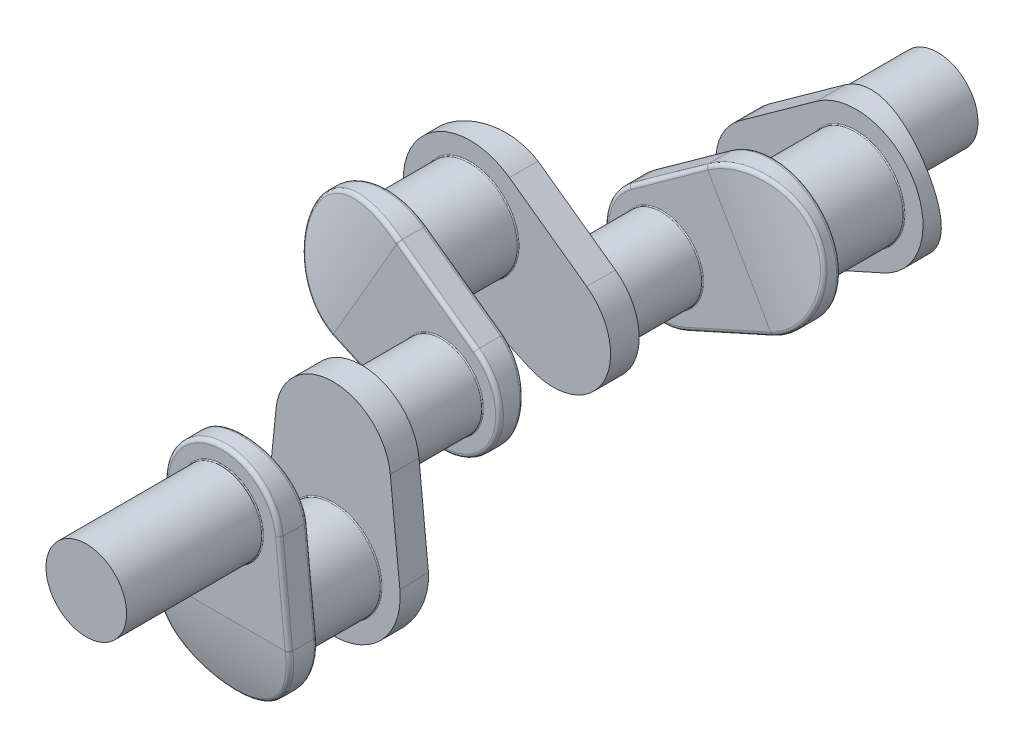
from build123d import *
from build123d.topology import SkipClean

# Parameters (mm, degrees)
SKETCH1_R             = 31.75
BOSS_EXTRUDE1_DEPTH   = 27.31
BOSS_EXTRUDE2_DEPTH   = 19
SKETCH3_R             = 26.75
BOSS_EXTRUDE3_DEPTH   = 26.67
CUT_EXTRUDE1_DEPTH    = 78.36
CUT_EXTRUDE2_DEPTH    = 78.36
FILLET1_R             = 2.54
FILLET2_R             = 0.64
FILLET2_OF_MIRROR2_R  = 0.64
LPATTERN1_COUNT       = 3
LPATTERN1_PITCH       = 145.96
BODY_MOVE_COPY1_ANGLE = 120
BODY_MOVE_COPY2_ANGLE = 120
SKETCH6_R             = 26.75
BOSS_EXTRUDE4_DEPTH   = 63.5
BOSS_EXTRUDE5_START   = 63.5
SKETCH7_R             = 26.75
BOSS_EXTRUDE5_DEPTH   = 63.5


with BuildPart() as part:
    # Sketch1 → Boss-Extrude1 (new body)
    with BuildSketch(Plane.XY):
        Circle(SKETCH1_R)
    boss_extrude1 = extrude(amount=BOSS_EXTRUDE1_DEPTH)

    # Sketch2 → Boss-Extrude2 (add)
    with BuildSketch(Plane.XY.offset(27.31)):
        with BuildLine():
            Line((-37.909021354, 67.31), (-44.227191579, 4.445))
            ThreePointArc((-44.227191579, 4.445), (0, -44.45), (44.227191579, 4.445))
            Line((44.227191579, 4.445), (37.909021354, 67.31))
            ThreePointArc((37.909021354, 67.31), (0, 101.6), (-37.909021354, 67.31))
        make_face()
    boss_extrude2 = extrude(amount=BOSS_EXTRUDE2_DEPTH)

    # Sketch3 → Boss-Extrude3 (add)
    with BuildSketch(Plane.XY.offset(46.31)):
        with Locations((0, 63.5)):
            Circle(SKETCH3_R)
    boss_extrude3 = extrude(amount=BOSS_EXTRUDE3_DEPTH)

    # Sketch4 → Cut-Extrude1 (cut, symmetric)
    with BuildSketch(Plane(origin=(0, 0, 0), x_dir=(0, 0, -1), z_dir=(1, 0, 0))):
        with BuildLine():
            Line((-46.31, 4.445), (-69.120375676, 4.445))
            Line((-69.120375676, 4.445), (-69.120375676, -44.45))
            Line((-69.120375676, -44.45), (-36.81, -44.45))
            ThreePointArc((-36.81, -44.45), (-43.371239463, -20.35441277), (-46.31, 4.445))
        make_face()
    cut_extrude1 = extrude(amount=CUT_EXTRUDE1_DEPTH, both=True, mode=Mode.SUBTRACT)

    # Sketch5 → Cut-Extrude2 (cut, symmetric)
    with BuildSketch(Plane(origin=(0, 0, 0), x_dir=(0, 0, -1), z_dir=(1, 0, 0))):
        with BuildLine():
            Line((-32.31, 101.6), (-13.345761104, 101.6))
            Line((-13.345761104, 101.6), (-13.345761104, 67.31))
            Line((-13.345761104, 67.31), (-27.31, 67.31))
            ThreePointArc((-27.31, 67.31), (-28.928803826, 84.583491714), (-32.31, 101.6))
        make_face()
    extrude(amount=CUT_EXTRUDE2_DEPTH, both=True, mode=Mode.SUBTRACT)

    # Fillet1
    fillet1_edges = [part.edges().sort_by_distance(p)[0] for p in [
        (41.068106467, 35.8775, 46.31),
        (-41.068106467, 35.8775, 46.31),
        (0, 101.6, 46.31),
        (-41.068106467, 35.8775, 27.31),
        (41.068106467, 35.8775, 27.31),
        (0, -44.45, 27.31),
        (0, -44.45, 36.81),
        (25.575363951, 91.740233016, 30.129815344),
    ]]
    fillet(fillet1_edges, radius=FILLET1_R)

    # Fillet2
    fillet2_edges = [part.edges().sort_by_distance(p)[0] for p in [
        (-31.75, 0, 27.31),
        (-26.75, 63.5, 46.31),
    ]]
    fillet(fillet2_edges, radius=FILLET2_R)

    # Mirror2: Boss-Extrude1, Boss-Extrude2, Boss-Extrude3, Cut-Extrude1 across plane
    add(boss_extrude1.mirror(Plane.XY))
    add(boss_extrude2.mirror(Plane.XY))
    add(boss_extrude3.mirror(Plane.XY))
    add(cut_extrude1.mirror(Plane.XY), mode=Mode.SUBTRACT)

    # Fillet2 of Mirror2
    fillet2_of_mirror2_edges = [part.edges().sort_by_distance(p)[0] for p in [
        (-31.75, 0, -27.31),
        (-26.75, 63.5, -46.31),
    ]]
    fillet(fillet2_of_mirror2_edges, radius=FILLET2_OF_MIRROR2_R)


with BuildPart() as lpattern1_1:
    # LPattern1: pattern copy
    add(part.part.moved(Location(Vector(0, 0, -1) * (1 * LPATTERN1_PITCH))))


with BuildPart() as lpattern1_2:
    # LPattern1: pattern copy
    add(part.part.moved(Location(Vector(0, 0, -1) * (2 * LPATTERN1_PITCH))))


with BuildPart() as lpattern1_1_1:
    # Body-Move/Copy1: moved
    add(lpattern1_1.part.rotate(Axis((0, 63.5, 0), (0, 0, -1)), BODY_MOVE_COPY1_ANGLE))


with BuildPart() as lpattern1_2_1:
    # Body-Move/Copy2: moved
    add(lpattern1_2.part.rotate(Axis((0, 63.5, 0), (0, 0, 1)), BODY_MOVE_COPY2_ANGLE))


with BuildPart() as part_1:
    add(part.part)

    # Combine4: union LPattern1_1, LPattern1_2
    add(lpattern1_1_1.part)
    add(lpattern1_2_1.part)

    # Sketch6 → Boss-Extrude4 (add)
    with SkipClean():  # the faces are left unmerged after this step: merging them gives an invalid solid
        with BuildSketch(Plane.XY.offset(72.98)):
            with Locations((0, 63.5)):
                Circle(SKETCH6_R)
        extrude(amount=BOSS_EXTRUDE4_DEPTH)

    # Sketch7 → Boss-Extrude5 (add)
    with SkipClean():  # the faces are left unmerged after this step: merging them gives an invalid solid
        with BuildSketch(Plane(origin=(0, 0, -364.9), x_dir=(-1, 0, 0), z_dir=(0, 0, -1)).offset(BOSS_EXTRUDE5_START)):
            with Locations((0, 63.5)):
                Circle(SKETCH7_R)
        extrude(amount=-BOSS_EXTRUDE5_DEPTH)


solid = part_1.part
